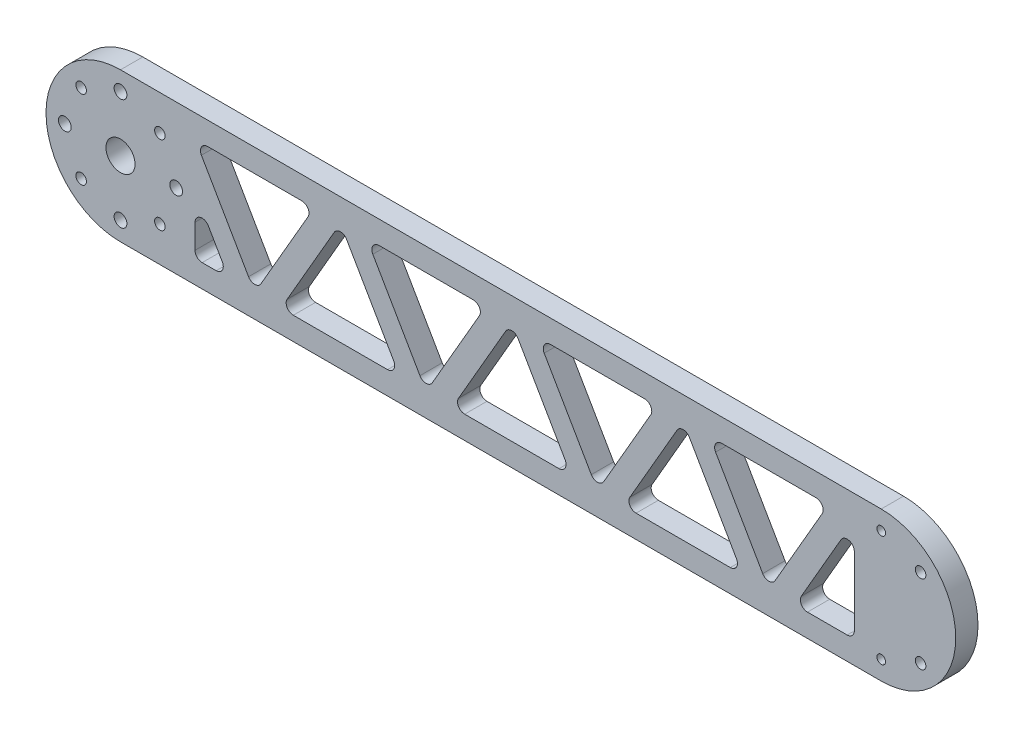
from build123d import *

# Parameters (mm, degrees)
SKETCH1_R              = 4
SKETCH1_R_2            = 1.25
SKETCH1_R_3            = 1.5
SKETCH1_R_4            = 1.8
BOSS_EXTRUDE1_DEPTH    = 6
CUT_EXTRUDE1_DEPTH     = 226.966811722
FILLET1_R              = 2
MOVE_FACE1_OUTLINE_R   = 4
MOVE_FACE1_OUTLINE_R_2 = 3.92
MOVE_FACE1_OUTLINE_R_3 = 1.25
MOVE_FACE1_OUTLINE_R_4 = 1.17
MOVE_FACE1_OUTLINE_R_5 = 1.5
MOVE_FACE1_OUTLINE_R_6 = 1.42
MOVE_FACE1_OUTLINE_R_7 = 1.8
MOVE_FACE1_OUTLINE_R_8 = 1.72
MOVE_FACE1_DEPTH       = 6


# Read off the part's stored shape, not the designer's step: Move Face1
with BuildPart() as part:
    # Sketch1 → Boss-Extrude1 (new body)
    with BuildSketch(Plane.XY):
        with BuildLine():
            Line((0, -20), (205, -20))
            ThreePointArc((205, -20), (225, 0), (205, 20))
            Line((205, 20), (0, 20))
            ThreePointArc((0, 20), (-20, 0), (0, -20))
        make_face()
        Circle(SKETCH1_R, mode=Mode.SUBTRACT)
        with Locations((205, -15)):
            Circle(SKETCH1_R_2, mode=Mode.SUBTRACT)
        with Locations((215.606601718, -10.606601718)):
            Circle(SKETCH1_R_3, mode=Mode.SUBTRACT)
        with Locations((205, 15)):
            Circle(SKETCH1_R_2, mode=Mode.SUBTRACT)
        with Locations((215.606601718, 10.606601718)):
            Circle(SKETCH1_R_3, mode=Mode.SUBTRACT)
        with Locations((0, -15)):
            Circle(SKETCH1_R_4, mode=Mode.SUBTRACT)
        with Locations((10.606601718, -10.606601718)):
            Circle(SKETCH1_R_3, mode=Mode.SUBTRACT)
        with Locations((-15, 0)):
            Circle(SKETCH1_R_4, mode=Mode.SUBTRACT)
        with Locations((-10.606601718, -10.606601718)):
            Circle(SKETCH1_R_3, mode=Mode.SUBTRACT)
        with Locations((0, 15)):
            Circle(SKETCH1_R_4, mode=Mode.SUBTRACT)
        with Locations((-10.606601718, 10.606601718)):
            Circle(SKETCH1_R_3, mode=Mode.SUBTRACT)
        with Locations((15, 0)):
            Circle(SKETCH1_R_4, mode=Mode.SUBTRACT)
        with Locations((10.606601718, 10.606601718)):
            Circle(SKETCH1_R_3, mode=Mode.SUBTRACT)
    extrude(amount=BOSS_EXTRUDE1_DEPTH)

    # Sketch2 → Cut-Extrude1 (cut, through all)
    with BuildSketch(Plane.XY.offset(6)):
        Polygon((20, 14), (52.331615075, 14), (36.165807537, -14), align=None)
        Polygon((43.094010768, -14), (59.259818305, 14), (75.425625842, -14), align=None)
        Polygon((66.188021535, 14), (82.353829072, -14), (98.51963661, 14), align=None)
        Polygon((89.282032303, -14), (105.44783984, 14), (121.613647377, -14), align=None)
        Polygon((112.37604307, 14), (128.541850608, -14), (144.707658145, 14), align=None)
        Polygon((20, 2), (20, -14), (29.237604307, -14), align=None)
        Polygon((135.470053838, -14), (151.635861375, 14), (167.801668913, -14), align=None)
        Polygon((174.729872143, -14), (158.564064606, 14), (190.89567968, 14), align=None)
        Polygon((181.658075373, -14), (197.82388291, 14), (197.82388291, -14), align=None)
    extrude(amount=-CUT_EXTRUDE1_DEPTH, mode=Mode.SUBTRACT)

    # Fillet1
    fillet1_edges = [part.edges().sort_by_distance(p)[0] for p in [
        (121.613647377, -14, 3),
        (89.282032303, -14, 3),
        (105.44783984, 14, 3),
        (112.37604307, 14, 3),
        (144.707658145, 14, 3),
        (128.541850608, -14, 3),
        (20, 2, 3),
        (29.237604307, -14, 3),
        (20, -14, 3),
        (167.801668913, -14, 3),
        (135.470053838, -14, 3),
        (151.635861375, 14, 3),
        (190.89567968, 14, 3),
        (174.729872143, -14, 3),
        (158.564064606, 14, 3),
        (197.82388291, -14, 3),
        (181.658075373, -14, 3),
        (197.82388291, 14, 3),
        (36.165807537, -14, 3),
        (20, 14, 3),
        (52.331615075, 14, 3),
        (75.425625842, -14, 3),
        (43.094010768, -14, 3),
        (59.259818305, 14, 3),
        (66.188021535, 14, 3),
        (98.51963661, 14, 3),
        (82.353829072, -14, 3),
    ]]
    fillet(fillet1_edges, radius=FILLET1_R)

    # Move Face1 outline → Move Face1 (add)
    # profile 1 of 23: a face of its own
    with BuildSketch(Plane.XY):
        with BuildLine():
            ThreePointArc((0, 20.08), (-20.08, 0), (0, -20.08))
            Line((0, -20.08), (205, -20.08))
            ThreePointArc((205, -20.08), (225.08, 0), (205, 20.08))
            Line((205, 20.08), (0, 20.08))
        make_face()
        with BuildLine():
            Line((205, -20), (0, -20))
            ThreePointArc((0, -20), (-20, 0), (0, 20))
            Line((0, 20), (205, 20))
            ThreePointArc((205, 20), (225, 0), (205, -20))
        make_face(mode=Mode.SUBTRACT)
    # profile 2 of 23: a face of its own
    with BuildSketch(Plane.XY):
        Circle(MOVE_FACE1_OUTLINE_R)
        Circle(MOVE_FACE1_OUTLINE_R_2, mode=Mode.SUBTRACT)
    # profile 3 of 23: a face of its own
    with BuildSketch(Plane.XY):
        with Locations((205, -15)):
            Circle(MOVE_FACE1_OUTLINE_R_3)
        with Locations((205, -15)):
            Circle(MOVE_FACE1_OUTLINE_R_4, mode=Mode.SUBTRACT)
    # profile 4 of 23: a face of its own
    with BuildSketch(Plane.XY):
        with Locations((215.606601718, -10.606601718)):
            Circle(MOVE_FACE1_OUTLINE_R_5)
        with Locations((215.606601718, -10.606601718)):
            Circle(MOVE_FACE1_OUTLINE_R_6, mode=Mode.SUBTRACT)
    # profile 5 of 23: a face of its own
    with BuildSketch(Plane.XY):
        with Locations((205, 15)):
            Circle(MOVE_FACE1_OUTLINE_R_3)
        with Locations((205, 15)):
            Circle(MOVE_FACE1_OUTLINE_R_4, mode=Mode.SUBTRACT)
    # profile 6 of 23: a face of its own
    with BuildSketch(Plane.XY):
        with Locations((215.606601718, 10.606601718)):
            Circle(MOVE_FACE1_OUTLINE_R_5)
        with Locations((215.606601718, 10.606601718)):
            Circle(MOVE_FACE1_OUTLINE_R_6, mode=Mode.SUBTRACT)
    # profile 7 of 23: a face of its own
    with BuildSketch(Plane.XY):
        with Locations((0, -15)):
            Circle(MOVE_FACE1_OUTLINE_R_7)
        with Locations((0, -15)):
            Circle(MOVE_FACE1_OUTLINE_R_8, mode=Mode.SUBTRACT)
    # profile 8 of 23: a face of its own
    with BuildSketch(Plane.XY):
        with Locations((10.606601718, -10.606601718)):
            Circle(MOVE_FACE1_OUTLINE_R_5)
        with Locations((10.606601718, -10.606601718)):
            Circle(MOVE_FACE1_OUTLINE_R_6, mode=Mode.SUBTRACT)
    # profile 9 of 23: a face of its own
    with BuildSketch(Plane.XY):
        with Locations((-15, 0)):
            Circle(MOVE_FACE1_OUTLINE_R_7)
        with Locations((-15, 0)):
            Circle(MOVE_FACE1_OUTLINE_R_8, mode=Mode.SUBTRACT)
    # profile 10 of 23: a face of its own
    with BuildSketch(Plane.XY):
        with Locations((-10.606601718, -10.606601718)):
            Circle(MOVE_FACE1_OUTLINE_R_5)
        with Locations((-10.606601718, -10.606601718)):
            Circle(MOVE_FACE1_OUTLINE_R_6, mode=Mode.SUBTRACT)
    # profile 11 of 23: a face of its own
    with BuildSketch(Plane.XY):
        with Locations((0, 15)):
            Circle(MOVE_FACE1_OUTLINE_R_7)
        with Locations((0, 15)):
            Circle(MOVE_FACE1_OUTLINE_R_8, mode=Mode.SUBTRACT)
    # profile 12 of 23: a face of its own
    with BuildSketch(Plane.XY):
        with Locations((-10.606601718, 10.606601718)):
            Circle(MOVE_FACE1_OUTLINE_R_5)
        with Locations((-10.606601718, 10.606601718)):
            Circle(MOVE_FACE1_OUTLINE_R_6, mode=Mode.SUBTRACT)
    # profile 13 of 23: a face of its own
    with BuildSketch(Plane.XY):
        with Locations((15, 0)):
            Circle(MOVE_FACE1_OUTLINE_R_7)
        with Locations((15, 0)):
            Circle(MOVE_FACE1_OUTLINE_R_8, mode=Mode.SUBTRACT)
    # profile 14 of 23: a face of its own
    with BuildSketch(Plane.XY):
        with Locations((10.606601718, 10.606601718)):
            Circle(MOVE_FACE1_OUTLINE_R_5)
        with Locations((10.606601718, 10.606601718)):
            Circle(MOVE_FACE1_OUTLINE_R_6, mode=Mode.SUBTRACT)
    # profile 15 of 23: a face of its own
    with BuildSketch(Plane.XY):
        with BuildLine():
            ThreePointArc((23.464101615, 14), (21.732050808, 13), (21.732050808, 11))
            Line((21.732050808, 11), (34.43375673, -11))
            ThreePointArc((34.43375673, -11), (36.165807538, -12), (37.897858345, -11))
            Line((37.897858345, -11), (50.599564267, 11))
            ThreePointArc((50.599564267, 11), (50.599564267, 13), (48.867513459, 14))
            Line((48.867513459, 14), (23.464101615, 14))
        make_face()
        with BuildLine():
            Line((34.503038762, -10.96), (21.80133284, 11.04))
            ThreePointArc((21.80133284, 11.04), (21.80133284, 12.96), (23.464101615, 13.92))
            Line((23.464101615, 13.92), (48.867513459, 13.92))
            ThreePointArc((48.867513459, 13.92), (50.530282235, 12.96), (50.530282235, 11.04))
            Line((50.530282235, 11.04), (37.828576313, -10.96))
            ThreePointArc((37.828576313, -10.96), (36.165807538, -11.92), (34.503038762, -10.96))
        make_face(mode=Mode.SUBTRACT)
    # profile 16 of 23: a face of its own
    with BuildSketch(Plane.XY):
        with BuildLine():
            ThreePointArc((96.787585802, 11), (96.787585802, 13), (95.055534995, 14))
            Line((95.055534995, 14), (69.65212315, 14))
            ThreePointArc((69.65212315, 14), (67.920072343, 13), (67.920072343, 11))
            Line((67.920072343, 11), (80.621778265, -11))
            ThreePointArc((80.621778265, -11), (82.353829072, -12), (84.08587988, -11))
            Line((84.08587988, -11), (96.787585802, 11))
        make_face()
        with BuildLine():
            Line((69.65212315, 13.92), (95.055534995, 13.92))
            ThreePointArc((95.055534995, 13.92), (96.71830377, 12.96), (96.71830377, 11.04))
            Line((96.71830377, 11.04), (84.016597848, -10.96))
            ThreePointArc((84.016597848, -10.96), (82.353829073, -11.92), (80.691060297, -10.96))
            Line((80.691060297, -10.96), (67.989354375, 11.04))
            ThreePointArc((67.989354375, 11.04), (67.989354375, 12.96), (69.65212315, 13.92))
        make_face(mode=Mode.SUBTRACT)
    # profile 17 of 23: a face of its own
    with BuildSketch(Plane.XY):
        with BuildLine():
            ThreePointArc((142.975607337, 11), (142.975607337, 13), (141.24355653, 14))
            Line((141.24355653, 14), (115.840144685, 14))
            ThreePointArc((115.840144685, 14), (114.108093878, 13), (114.108093878, 11))
            Line((114.108093878, 11), (126.8097998, -11))
            ThreePointArc((126.8097998, -11), (128.541850608, -12), (130.273901415, -11))
            Line((130.273901415, -11), (142.975607337, 11))
        make_face()
        with BuildLine():
            Line((115.840144685, 13.92), (141.24355653, 13.92))
            ThreePointArc((141.24355653, 13.92), (142.906325305, 12.96), (142.906325305, 11.04))
            Line((142.906325305, 11.04), (130.204619383, -10.96))
            ThreePointArc((130.204619383, -10.96), (128.541850608, -11.92), (126.879081832, -10.96))
            Line((126.879081832, -10.96), (114.17737591, 11.04))
            ThreePointArc((114.17737591, 11.04), (114.17737591, 12.96), (115.840144685, 13.92))
        make_face(mode=Mode.SUBTRACT)
    # profile 18 of 23: a face of its own
    with BuildSketch(Plane.XY):
        with BuildLine():
            ThreePointArc((189.163628873, 11), (189.163628873, 13), (187.431578065, 14))
            Line((187.431578065, 14), (162.028166221, 14))
            ThreePointArc((162.028166221, 14), (160.296115413, 13), (160.296115413, 11))
            Line((160.296115413, 11), (172.997821335, -11))
            ThreePointArc((172.997821335, -11), (174.729872142, -12), (176.46192295, -11))
            Line((176.46192295, -11), (189.163628873, 11))
        make_face()
        with BuildLine():
            Line((162.028166221, 13.92), (187.431578065, 13.92))
            ThreePointArc((187.431578065, 13.92), (189.09434684, 12.96), (189.09434684, 11.04))
            Line((189.09434684, 11.04), (176.392640918, -10.96))
            ThreePointArc((176.392640918, -10.96), (174.729872143, -11.92), (173.067103368, -10.96))
            Line((173.067103368, -10.96), (160.365397445, 11.04))
            ThreePointArc((160.365397445, 11.04), (160.365397445, 12.96), (162.028166221, 13.92))
        make_face(mode=Mode.SUBTRACT)
    # profile 19 of 23: a face of its own
    with BuildSketch(Plane.XY):
        with BuildLine():
            ThreePointArc((44.826061575, -11), (44.826061575, -13), (46.558112383, -14))
            Line((46.558112383, -14), (71.961524227, -14))
            ThreePointArc((71.961524227, -14), (73.693575035, -13), (73.693575035, -11))
            Line((73.693575035, -11), (60.991869112, 11))
            ThreePointArc((60.991869112, 11), (59.259818305, 12), (57.527767497, 11))
            Line((57.527767497, 11), (44.826061575, -11))
        make_face()
        with BuildLine():
            Line((71.961524227, -13.92), (46.558112383, -13.92))
            ThreePointArc((46.558112383, -13.92), (44.895343607, -12.96), (44.895343607, -11.04))
            Line((44.895343607, -11.04), (57.59704953, 10.96))
            ThreePointArc((57.59704953, 10.96), (59.259818305, 11.92), (60.92258708, 10.96))
            Line((60.92258708, 10.96), (73.624293002, -11.04))
            ThreePointArc((73.624293002, -11.04), (73.624293002, -12.96), (71.961524227, -13.92))
        make_face(mode=Mode.SUBTRACT)
    # profile 20 of 23: a face of its own
    with BuildSketch(Plane.XY):
        with BuildLine():
            ThreePointArc((91.01408311, -11), (91.01408311, -13), (92.746133918, -14))
            Line((92.746133918, -14), (118.149545762, -14))
            ThreePointArc((118.149545762, -14), (119.88159657, -13), (119.88159657, -11))
            Line((119.88159657, -11), (107.179890648, 11))
            ThreePointArc((107.179890648, 11), (105.44783984, 12), (103.715789032, 11))
            Line((103.715789032, 11), (91.01408311, -11))
        make_face()
        with BuildLine():
            Line((118.149545762, -13.92), (92.746133918, -13.92))
            ThreePointArc((92.746133918, -13.92), (91.083365143, -12.96), (91.083365143, -11.04))
            Line((91.083365143, -11.04), (103.785071065, 10.96))
            ThreePointArc((103.785071065, 10.96), (105.44783984, 11.92), (107.110608615, 10.96))
            Line((107.110608615, 10.96), (119.812314538, -11.04))
            ThreePointArc((119.812314538, -11.04), (119.812314538, -12.96), (118.149545762, -13.92))
        make_face(mode=Mode.SUBTRACT)
    # profile 21 of 23: a face of its own
    with BuildSketch(Plane.XY):
        with BuildLine():
            ThreePointArc((20, -12), (20.585786438, -13.414213562), (22, -14))
            Line((22, -14), (25.773502692, -14))
            ThreePointArc((25.773502692, -14), (27.505553499, -13), (27.505553499, -11))
            Line((27.505553499, -11), (23.732050808, -4.464101615))
            ThreePointArc((23.732050808, -4.464101615), (21.48236191, -3.532249963), (20, -5.464101615))
            Line((20, -5.464101615), (20, -12))
        make_face()
        with BuildLine():
            Line((25.773502692, -13.92), (22, -13.92))
            ThreePointArc((22, -13.92), (20.64235498, -13.35764502), (20.08, -12))
            Line((20.08, -12), (20.08, -5.464101615))
            ThreePointArc((20.08, -5.464101615), (21.503067433, -3.609524029), (23.662768775, -4.504101615))
            Line((23.662768775, -4.504101615), (27.436271467, -11.04))
            ThreePointArc((27.436271467, -11.04), (27.436271467, -12.96), (25.773502692, -13.92))
        make_face(mode=Mode.SUBTRACT)
    # profile 22 of 23: a face of its own
    with BuildSketch(Plane.XY):
        with BuildLine():
            ThreePointArc((137.202104645, -11), (137.202104645, -13), (138.934155453, -14))
            Line((138.934155453, -14), (164.337567297, -14))
            ThreePointArc((164.337567297, -14), (166.069618105, -13), (166.069618105, -11))
            Line((166.069618105, -11), (153.367912183, 11))
            ThreePointArc((153.367912183, 11), (151.635861376, 12), (149.903810568, 11))
            Line((149.903810568, 11), (137.202104645, -11))
        make_face()
        with BuildLine():
            Line((164.337567297, -13.92), (138.934155453, -13.92))
            ThreePointArc((138.934155453, -13.92), (137.271386678, -12.96), (137.271386678, -11.04))
            Line((137.271386678, -11.04), (149.9730926, 10.96))
            ThreePointArc((149.9730926, 10.96), (151.635861375, 11.92), (153.298630151, 10.96))
            Line((153.298630151, 10.96), (166.000336073, -11.04))
            ThreePointArc((166.000336073, -11.04), (166.000336073, -12.96), (164.337567297, -13.92))
        make_face(mode=Mode.SUBTRACT)
    # profile 23 of 23: a face of its own
    with BuildSketch(Plane.XY):
        with BuildLine():
            ThreePointArc((183.390126181, -11), (183.390126181, -13), (185.122176988, -14))
            Line((185.122176988, -14), (195.82388291, -14))
            ThreePointArc((195.82388291, -14), (197.238096473, -13.414213563), (197.82388291, -12))
            Line((197.82388291, -12), (197.82388291, 6.535898385))
            ThreePointArc((197.82388291, 6.535898385), (196.341521, 8.467750037), (194.091832103, 7.535898385))
            Line((194.091832103, 7.535898385), (183.390126181, -11))
        make_face()
        with BuildLine():
            Line((195.82388291, -13.92), (185.122176988, -13.92))
            ThreePointArc((185.122176988, -13.92), (183.459408213, -12.96), (183.459408213, -11.04))
            Line((183.459408213, -11.04), (194.161114135, 7.495898385))
            ThreePointArc((194.161114135, 7.495898385), (196.320815477, 8.390475971), (197.74388291, 6.535898385))
            Line((197.74388291, 6.535898385), (197.74388291, -12))
            ThreePointArc((197.74388291, -12), (197.18152793, -13.35764502), (195.82388291, -13.92))
        make_face(mode=Mode.SUBTRACT)
    extrude(amount=MOVE_FACE1_DEPTH)


solid = part.part
